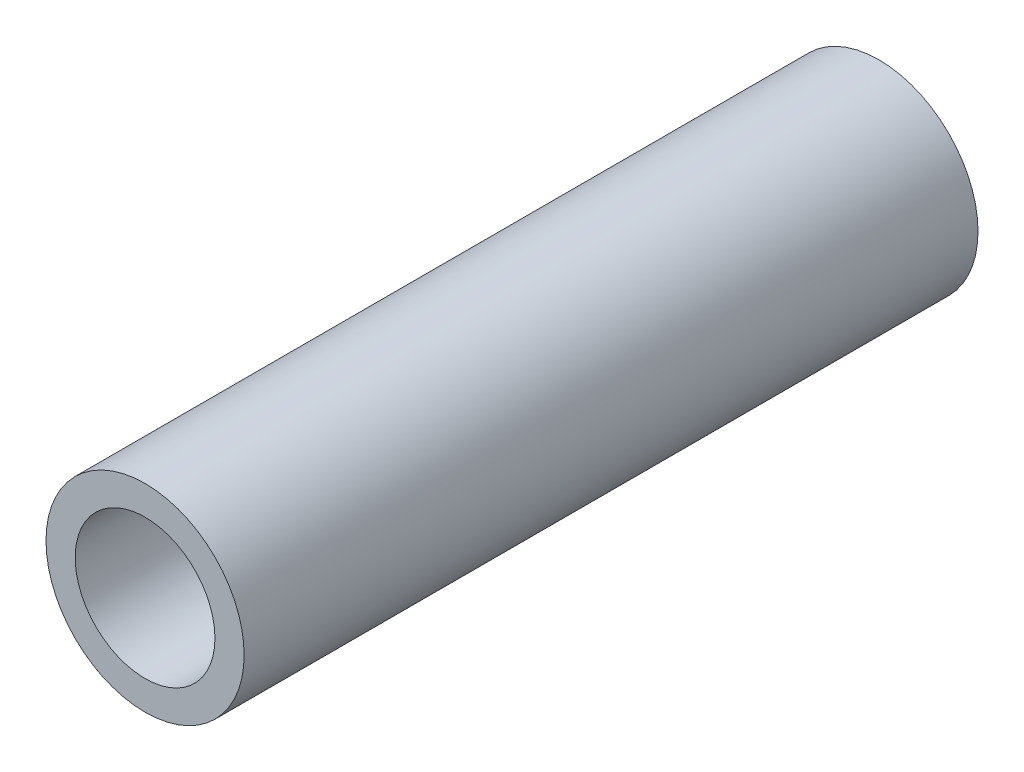
from build123d import *

# Parameters (mm, degrees)
SKETCH1_R   = 13.5
SKETCH1_R_2 = 9.525


with BuildPart() as part:
    # Sweep1: sweep along a curve in space
    with BuildLine() as sweep1_path:
        Line((0, 0, 0), (0, 0, -100))
    # Sketch1 → Sweep1 (sweep)
    with BuildSketch(Plane.XY):
        Circle(SKETCH1_R)
        Circle(SKETCH1_R_2, mode=Mode.SUBTRACT)
    sweep(path=sweep1_path.line)


solid = part.part
